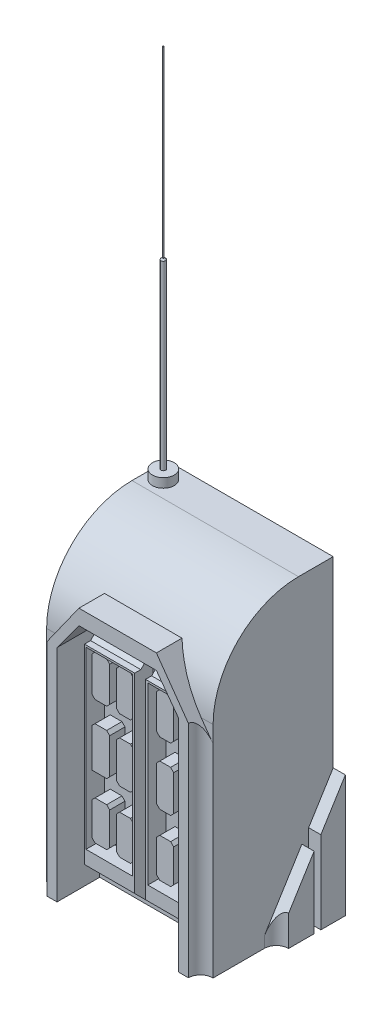
from build123d import *

# Parameters (mm, degrees)
SKETCH1_W           = 138.703768062
SKETCH1_H           = 100.037448714
BOSS_EXTRUDE1_DEPTH = 254
SKETCH2_W           = 14.801133862
SKETCH2_H           = 32.473864261
SKETCH2_W_2         = 14.135268146
SKETCH2_H_2         = 34.772366101
SKETCH2_H_3         = 34.104021324
CUT_EXTRUDE1_DEPTH  = 25.4
SKETCH2_3_W         = 14.801133862
SKETCH2_3_H         = 34.104021324
SKETCH2_3_W_2       = 14.135268146
SKETCH2_3_H_2       = 34.772366101
SKETCH2_3_H_3       = 32.473864261
CUT_EXTRUDE2_DEPTH  = 12.7
BOSS_EXTRUDE2_DEPTH = 10.16
FILLET1_R           = 71.12
CHAMFER1_SIZE       = 2.54
SKETCH3_W           = 41.849650405
SKETCH3_H           = 148.834830101
SKETCH3_W_2         = 38.660028617
SKETCH3_H_2         = 145.84015385
BOSS_EXTRUDE3_DEPTH = 15.24
BOSS_EXTRUDE4_DEPTH = 10.16
BOSS_EXTRUDE5_DEPTH = 10.16
SKETCH6_R           = 9.027087343
BOSS_EXTRUDE6_DEPTH = 7.62
SKETCH7_R           = 1.94038845
BOSS_EXTRUDE7_DEPTH = 152.4
CHAMFER2_SIZE       = 1.27
SKETCH8_R           = 0.422277869
BOSS_EXTRUDE8_DEPTH = 152.4
FILLET2_R           = 10.16
FILLET3_R           = 10.16
CHAMFER3_SIZE       = 25.4
CHAMFER4_SIZE       = 10.16
FILLET4_R           = 10.16
FILLET5_R           = 10.16


# Some blends are built 0.0001 mm under size
with BuildPart() as part:
    # Sketch1 → Boss-Extrude1 (new body)
    with BuildSketch(Plane(origin=(0, 0, 0), x_dir=(1, 0, 0), z_dir=(0, 1, 0))):
        with Locations((1.617227834, -2.755559595)):
            Rectangle(SKETCH1_W, SKETCH1_H)
    extrude(amount=BOSS_EXTRUDE1_DEPTH)

    # Sketch2 → Cut-Extrude1 (cut)
    with BuildSketch(Plane.XY.offset(52.774283952)):
        Polygon((-48.907831558, 183.578664673), (-48.907831558, 0), (52.142287226, 0), (52.142287226, 183.578664673), (33.894210103, 208.457361125), (-30.659754435, 208.457361125), align=None)
        with Locations((-35.272200607, 51.772839723)):
            Rectangle(SKETCH2_W, SKETCH2_H, mode=Mode.SUBTRACT)
        with Locations((-15.120681888, 51.772839723)):
            Rectangle(SKETCH2_W_2, SKETCH2_H, mode=Mode.SUBTRACT)
        with Locations((-35.272200607, 104.219805315)):
            Rectangle(SKETCH2_W, SKETCH2_H_2, mode=Mode.SUBTRACT)
        with Locations((-15.120681888, 104.219805315)):
            Rectangle(SKETCH2_W_2, SKETCH2_H_2, mode=Mode.SUBTRACT)
        with Locations((18.355137556, 51.772839723)):
            Rectangle(SKETCH2_W_2, SKETCH2_H, mode=Mode.SUBTRACT)
        with Locations((38.506656275, 51.772839723)):
            Rectangle(SKETCH2_W, SKETCH2_H, mode=Mode.SUBTRACT)
        with Locations((18.355137556, 104.219805315)):
            Rectangle(SKETCH2_W_2, SKETCH2_H_2, mode=Mode.SUBTRACT)
        with Locations((38.506656275, 104.219805315)):
            Rectangle(SKETCH2_W, SKETCH2_H_2, mode=Mode.SUBTRACT)
        with Locations((-35.272200607, 156.089607488)):
            Rectangle(SKETCH2_W, SKETCH2_H_3, mode=Mode.SUBTRACT)
        with Locations((-15.120681888, 156.089607488)):
            Rectangle(SKETCH2_W_2, SKETCH2_H_3, mode=Mode.SUBTRACT)
        with Locations((18.355137556, 156.089607488)):
            Rectangle(SKETCH2_W_2, SKETCH2_H_3, mode=Mode.SUBTRACT)
        with Locations((38.506656275, 156.089607488)):
            Rectangle(SKETCH2_W, SKETCH2_H_3, mode=Mode.SUBTRACT)
    extrude(amount=-CUT_EXTRUDE1_DEPTH, mode=Mode.SUBTRACT)

    # Sketch2<3> → Cut-Extrude2 (cut)
    with BuildSketch(Plane.XY.offset(52.774283952)):
        with Locations((-35.272200607, 156.089607488)):
            Rectangle(SKETCH2_3_W, SKETCH2_3_H)
        with Locations((-15.120681888, 156.089607488)):
            Rectangle(SKETCH2_3_W_2, SKETCH2_3_H)
        with Locations((-35.272200607, 104.219805315)):
            Rectangle(SKETCH2_3_W, SKETCH2_3_H_2)
        with Locations((-15.120681888, 104.219805315)):
            Rectangle(SKETCH2_3_W_2, SKETCH2_3_H_2)
        with Locations((-35.272200607, 51.772839723)):
            Rectangle(SKETCH2_3_W, SKETCH2_3_H_3)
        with Locations((-15.120681888, 51.772839723)):
            Rectangle(SKETCH2_3_W_2, SKETCH2_3_H_3)
        with Locations((18.355137556, 156.089607488)):
            Rectangle(SKETCH2_3_W_2, SKETCH2_3_H)
        with Locations((38.506656275, 156.089607488)):
            Rectangle(SKETCH2_3_W, SKETCH2_3_H)
        with Locations((38.506656275, 104.219805315)):
            Rectangle(SKETCH2_3_W, SKETCH2_3_H_2)
        with Locations((18.355137556, 104.219805315)):
            Rectangle(SKETCH2_3_W_2, SKETCH2_3_H_2)
        with Locations((18.355137556, 51.772839723)):
            Rectangle(SKETCH2_3_W_2, SKETCH2_3_H_3)
        with Locations((38.506656275, 51.772839723)):
            Rectangle(SKETCH2_3_W, SKETCH2_3_H_3)
    extrude(amount=-CUT_EXTRUDE2_DEPTH, mode=Mode.SUBTRACT)

    # Sketch2<5> → Boss-Extrude2 (add)
    with BuildSketch(Plane.XY.offset(52.774283952)):
        Polygon((-57.322808298, 183.578664673), (-57.322808298, 0), (-48.907831558, 0), (-48.907831558, 183.578664673), (-30.659754435, 208.457361125), (33.894210103, 208.457361125), (52.142287226, 183.578664673), (52.142287226, 0), (60.557263966, 0), (60.557263966, 183.578664673), (33.894210103, 221.102001876), (-30.659754435, 221.102001876), align=None)
    extrude(amount=BOSS_EXTRUDE2_DEPTH)

    # Fillet1
    # the kernel refuses this fillet: 71.12 mm, written as the material it takes off along each edge
    with BuildSketch(Plane(origin=(248.769111865, 254, 52.774283952), x_dir=(0, 0, -1), z_dir=(-1, 0, 0))) as fillet1_piece_1_section:
        with BuildLine():
            CenterArc((FILLET1_R, FILLET1_R), FILLET1_R, 180, 90)
            Line((0, FILLET1_R), (0, 0))
            Line((0, 0), (FILLET1_R, 0))
        make_face()
    fillet1_piece_1 = extrude(amount=494.303768061, mode=Mode.PRIVATE)
    fillet1_piece_1 = split(fillet1_piece_1, bisect_by=Plane(origin=(65.763187915, 221.102001876, 35.066185576), z_dir=(0, 1, 0)), keep=Keep.TOP, mode=Mode.PRIVATE)
    add(fillet1_piece_1, mode=Mode.SUBTRACT)
    with BuildSketch(Plane(origin=(248.769111865, 254, 52.774283952), x_dir=(0, 0, -1), z_dir=(-1, 0, 0))) as fillet1_piece_2_section:
        with BuildLine():
            CenterArc((FILLET1_R, FILLET1_R), FILLET1_R, 180, 90)
            Line((0, FILLET1_R), (0, 0))
            Line((0, 0), (FILLET1_R, 0))
        make_face()
    fillet1_piece_2 = extrude(amount=494.303768061, mode=Mode.PRIVATE)
    fillet1_piece_2 = split(fillet1_piece_2, bisect_by=Plane(origin=(47.159512372, 202.433532288, 48.709976317), z_dir=(0.8151626082452436, 0.5792321832553953, 0)), keep=Keep.TOP, mode=Mode.PRIVATE)
    add(fillet1_piece_2, mode=Mode.SUBTRACT)
    with BuildSketch(Plane(origin=(248.769111865, 254, 52.774283952), x_dir=(0, 0, -1), z_dir=(-1, 0, 0))) as fillet1_piece_3_section:
        with BuildLine():
            CenterArc((FILLET1_R, FILLET1_R), FILLET1_R, 180, 90)
            Line((0, FILLET1_R), (0, 0))
            Line((0, 0), (FILLET1_R, 0))
        make_face()
    fillet1_piece_3 = extrude(amount=494.303768061, mode=Mode.PRIVATE)
    fillet1_piece_3 = split(fillet1_piece_3, bisect_by=Plane(origin=(60.557263966, 183.299199574, 52.773597591), z_dir=(1, 0, 0)), keep=Keep.TOP, mode=Mode.PRIVATE)
    add(fillet1_piece_3, mode=Mode.SUBTRACT)
    with BuildSketch(Plane(origin=(248.769111865, 254, 52.774283952), x_dir=(0, 0, -1), z_dir=(-1, 0, 0))) as fillet1_piece_4_section:
        with BuildLine():
            CenterArc((FILLET1_R, FILLET1_R), FILLET1_R, 180, 90)
            Line((0, FILLET1_R), (0, 0))
            Line((0, 0), (FILLET1_R, 0))
        make_face()
    fillet1_piece_4 = extrude(amount=494.303768061, mode=Mode.PRIVATE)
    fillet1_piece_4 = split(fillet1_piece_4, bisect_by=Plane(origin=(-36.570941557, 212.783094791, 48.549077149), z_dir=(-0.8151626082452436, 0.5792321832553953, 0)), keep=Keep.TOP, mode=Mode.PRIVATE)
    add(fillet1_piece_4, mode=Mode.SUBTRACT)
    with BuildSketch(Plane(origin=(248.769111865, 254, 52.774283952), x_dir=(0, 0, -1), z_dir=(-1, 0, 0))) as fillet1_piece_5_section:
        with BuildLine():
            CenterArc((FILLET1_R, FILLET1_R), FILLET1_R, 180, 90)
            Line((0, FILLET1_R), (0, 0))
            Line((0, 0), (FILLET1_R, 0))
        make_face()
    fillet1_piece_5 = extrude(amount=494.303768061, mode=Mode.PRIVATE)
    fillet1_piece_5 = split(fillet1_piece_5, bisect_by=Plane(origin=(-57.322808298, 183.299199574, 52.773597591), z_dir=(-1, 0, 0)), keep=Keep.TOP, mode=Mode.PRIVATE)
    add(fillet1_piece_5, mode=Mode.SUBTRACT)

    # Chamfer1
    chamfer1_edges = [part.edges().sort_by_distance(p)[0] for p in [
        (45.907223206, 35.535907592, 33.724283952),
        (45.907223206, 68.009771853, 33.724283952),
        (31.106089344, 68.009771853, 33.724283952),
        (11.287503483, 35.535907592, 33.724283952),
        (25.422771629, 35.535907592, 33.724283952),
        (25.422771629, 68.009771853, 33.724283952),
        (11.287503483, 86.833622265, 33.724283952),
        (25.422771629, 86.833622265, 33.724283952),
        (25.422771629, 121.605988366, 33.724283952),
        (31.106089344, 121.605988366, 33.724283952),
        (31.106089344, 86.833622265, 33.724283952),
        (45.907223206, 86.833622265, 33.724283952),
        (-27.871633676, 35.535907592, 33.724283952),
        (-27.871633676, 68.009771853, 33.724283952),
        (-42.672767538, 68.009771853, 33.724283952),
        (-22.188315961, 121.605988366, 33.724283952),
        (-22.188315961, 86.833622265, 33.724283952),
        (-8.053047815, 86.833622265, 33.724283952),
        (-22.188315961, 173.14161815, 33.724283952),
        (-22.188315961, 139.037596826, 33.724283952),
        (-8.053047815, 139.037596826, 33.724283952),
        (-22.188315961, 35.535907592, 33.724283952),
        (-8.053047815, 35.535907592, 33.724283952),
        (-8.053047815, 68.009771853, 33.724283952),
        (-27.871633676, 139.037596826, 33.724283952),
        (-27.871633676, 173.14161815, 33.724283952),
        (-42.672767538, 173.14161815, 33.724283952),
        (-27.871633676, 86.833622265, 33.724283952),
        (-27.871633676, 121.605988366, 33.724283952),
        (-42.672767538, 121.605988366, 33.724283952),
        (25.422771629, 139.037596826, 33.724283952),
        (25.422771629, 173.14161815, 33.724283952),
        (11.287503483, 173.14161815, 33.724283952),
        (45.907223206, 173.14161815, 33.724283952),
        (31.106089344, 173.14161815, 33.724283952),
        (31.106089344, 139.037596826, 33.724283952),
        (31.106089344, 35.535907592, 33.724283952),
        (11.287503483, 68.009771853, 33.724283952),
        (11.287503483, 121.605988366, 33.724283952),
        (45.907223206, 121.605988366, 33.724283952),
        (-42.672767538, 35.535907592, 33.724283952),
        (-8.053047815, 121.605988366, 33.724283952),
        (-8.053047815, 173.14161815, 33.724283952),
        (-22.188315961, 68.009771853, 33.724283952),
        (-42.672767538, 139.037596826, 33.724283952),
        (11.287503483, 139.037596826, 33.724283952),
        (45.907223206, 139.037596826, 33.724283952),
    ]]
    chamfer(chamfer1_edges, length=CHAMFER1_SIZE)

    # Sketch3 → Boss-Extrude3 (add)
    # profile 1 of 2: a face of its own
    with BuildSketch(Plane.XY.offset(27.374283952)):
        with Locations((-25.429235498, 102.729993703)):
            Rectangle(SKETCH3_W, SKETCH3_H)
        with Locations((-25.759843441, 102.647284592)):
            Rectangle(SKETCH3_W_2, SKETCH3_H_2, mode=Mode.SUBTRACT)
    # profile 2 of 2: a face of its own
    with BuildSketch(Plane.XY.offset(27.374283952)):
        with Locations((25.429235498, 102.729993703)):
            Rectangle(SKETCH3_W, SKETCH3_H)
        with Locations((25.759843441, 102.647284592)):
            Rectangle(SKETCH3_W_2, SKETCH3_H_2, mode=Mode.SUBTRACT)
    extrude(amount=BOSS_EXTRUDE3_DEPTH)

    # Sketch4 → Boss-Extrude4 (add)
    with BuildSketch(Plane.ZY.offset(67.734656197)):
        Polygon((-47.263164762, 0), (-26.325953361, 0), (-26.325953361, 67.843997481), (-47.263164762, 101.6), align=None)
        Polygon((0, 0), (0, 25.4), (-20.622596421, 58.648764767), (-20.622596421, 0), align=None)
    extrude(amount=BOSS_EXTRUDE4_DEPTH)

    # Sketch5 → Boss-Extrude5 (add)
    with BuildSketch(Plane(origin=(70.969111865, 0, 0), x_dir=(0, 0, -1), z_dir=(1, 0, 0))):
        Polygon((0, 0), (0, 25.4), (21.213880181, 59.60206154), (21.213880181, 0), align=None)
        Polygon((47.263164762, 101.6), (47.263164762, 0), (26.829112213, 0), (26.829112213, 68.655214942), align=None)
    extrude(amount=BOSS_EXTRUDE5_DEPTH)

    # Sketch6 → Boss-Extrude6 (add)
    with BuildSketch(Plane(origin=(0, 254, 0), x_dir=(1, 0, 0), z_dir=(0, 1, 0))):
        with Locations(Location((-55.486515203, 32.221084153, 0), (0, 0, 90))):
            Circle(SKETCH6_R)
    extrude(amount=BOSS_EXTRUDE6_DEPTH)

    # Sketch7 → Boss-Extrude7 (add)
    with BuildSketch(Plane(origin=(0, 261.62, 0), x_dir=(1, 0, 0), z_dir=(0, 1, 0))):
        with Locations(Location((-55.486515203, 32.221084153, 0), (0, 0, 90))):
            Circle(SKETCH7_R)
    extrude(amount=BOSS_EXTRUDE7_DEPTH)

    # Chamfer2
    chamfer2_edges = [part.edges().sort_by_distance(p)[0] for p in [
        (-55.486515203, 414.02, -30.280695703),
    ]]
    chamfer(chamfer2_edges, length=CHAMFER2_SIZE)

    # Sketch8 → Boss-Extrude8 (add)
    with BuildSketch(Plane(origin=(0, 414.02, 0), x_dir=(1, 0, 0), z_dir=(0, 1, 0))):
        with Locations(Location((-55.486515203, 32.221084153, 0), (0, 0, 270))):
            Circle(SKETCH8_R)
    extrude(amount=BOSS_EXTRUDE8_DEPTH)

    # Fillet2
    # the kernel refuses this fillet: 10.16 mm, written as the material it adds along each edge
    with BuildSketch(Plane(origin=(-57.322808298, 208.28, 52.774283952), x_dir=(-1, 0, 0), z_dir=(0, -1, 0))) as fillet2_piece_1_section:
        with BuildLine():
            CenterArc((FILLET2_R, -FILLET2_R), FILLET2_R, 90, 90)
            Line((0, -FILLET2_R), (-FILLET2_R * 0.02, -FILLET2_R))
            Line((-FILLET2_R * 0.02, -FILLET2_R), (-FILLET2_R * 0.02, FILLET2_R * 0.02))
            Line((-FILLET2_R * 0.02, FILLET2_R * 0.02), (FILLET2_R, FILLET2_R * 0.02))
            Line((FILLET2_R, FILLET2_R * 0.02), (FILLET2_R, 0))
        make_face()
    fillet2_piece_1 = extrude(amount=208.28, mode=Mode.PRIVATE)
    fillet2_piece_1 = fillet2_piece_1 - Plane(origin=(-59.585968411, 182.88, -18.345716048), x_dir=(0, 0, -1), z_dir=(1, 0, 0)) * Cylinder(71.12, 458, mode=Mode.PRIVATE)
    fillet2_piece_1 = split(fillet2_piece_1, bisect_by=Plane(origin=(-102.188481493, 120.438493529, 55.097413319), z_dir=(0.8151626082453484, -0.5792321832552476, 0)), keep=Keep.TOP, mode=Mode.PRIVATE)
    add(fillet2_piece_1)
    with BuildSketch(Plane(origin=(-57.322808298, 208.28, 52.774283952), x_dir=(-1, 0, 0), z_dir=(0, -1, 0))) as fillet2_piece_2_section:
        with BuildLine():
            CenterArc((FILLET2_R, -FILLET2_R), FILLET2_R, 90, 90)
            Line((0, -FILLET2_R), (-FILLET2_R * 0.02, -FILLET2_R))
            Line((-FILLET2_R * 0.02, -FILLET2_R), (-FILLET2_R * 0.02, FILLET2_R * 0.02))
            Line((-FILLET2_R * 0.02, FILLET2_R * 0.02), (FILLET2_R, FILLET2_R * 0.02))
            Line((FILLET2_R, FILLET2_R * 0.02), (FILLET2_R, 0))
        make_face()
    fillet2_piece_2 = extrude(amount=208.28, mode=Mode.PRIVATE)
    fillet2_piece_2 = fillet2_piece_2 & Plane(origin=(-58.343918637, 182.88, -18.345716048), x_dir=(0, 0, -1), z_dir=(1, 0, 0)) * Cylinder(71.12, 458, mode=Mode.PRIVATE)
    fillet2_piece_2 = split(fillet2_piece_2, bisect_by=Plane(origin=(-59.15746069, 180.996729358, 52.644516297), z_dir=(0.8151626082453484, -0.5792321832552476, 0)), keep=Keep.TOP, mode=Mode.PRIVATE)
    add(fillet2_piece_2)
    with BuildSketch(Plane(origin=(-57.322808298, 208.28, 52.774283952), x_dir=(-1, 0, 0), z_dir=(0, -1, 0))) as fillet2_piece_3_section:
        with BuildLine():
            CenterArc((FILLET2_R, -FILLET2_R), FILLET2_R, 90, 90)
            Line((0, -FILLET2_R), (-FILLET2_R * 0.02, -FILLET2_R))
            Line((-FILLET2_R * 0.02, -FILLET2_R), (-FILLET2_R * 0.02, FILLET2_R * 0.02))
            Line((-FILLET2_R * 0.02, FILLET2_R * 0.02), (FILLET2_R, FILLET2_R * 0.02))
            Line((FILLET2_R, FILLET2_R * 0.02), (FILLET2_R, 0))
        make_face()
    fillet2_piece_3 = extrude(amount=208.28, mode=Mode.PRIVATE)
    fillet2_piece_3 = fillet2_piece_3 & Plane(origin=(-62.777612248, 182.88, -18.345716048), x_dir=(0, 0, -1), z_dir=(1, 0, 0)) * Cylinder(71.12, 458, mode=Mode.PRIVATE)
    fillet2_piece_3 = split(fillet2_piece_3, bisect_by=Plane(origin=(-59.342926766, 180.735720018, 52.653319863), z_dir=(-0.8151626082453484, 0.5792321832552476, 0)), keep=Keep.TOP, mode=Mode.PRIVATE)
    add(fillet2_piece_3)

    # Fillet3
    # the kernel refuses this fillet: 10.16 mm, written as the material it adds along each edge
    with BuildSketch(Plane(origin=(60.557263966, 0, 52.774283952), x_dir=(0, 0, 1), z_dir=(0, 1, 0))) as fillet3_piece_1_section:
        with BuildLine():
            CenterArc((FILLET3_R, FILLET3_R), FILLET3_R, 180, 90)
            Line((0, FILLET3_R), (-FILLET3_R * 0.02, FILLET3_R))
            Line((-FILLET3_R * 0.02, FILLET3_R), (-FILLET3_R * 0.02, -FILLET3_R * 0.02))
            Line((-FILLET3_R * 0.02, -FILLET3_R * 0.02), (FILLET3_R, -FILLET3_R * 0.02))
            Line((FILLET3_R, -FILLET3_R * 0.02), (FILLET3_R, 0))
        make_face()
    fillet3_piece_1 = extrude(amount=208.28, mode=Mode.PRIVATE)
    fillet3_piece_1 = fillet3_piece_1 - Plane(origin=(62.820424079, 182.88, -18.345716048), x_dir=(0, 0, -1), z_dir=(1, 0, 0)) * Cylinder(71.12, 458, mode=Mode.PRIVATE)
    fillet3_piece_1 = split(fillet3_piece_1, bisect_by=Plane(origin=(105.422937158, 120.438493534, 55.097413318), z_dir=(-0.8151626082453484, -0.5792321832552476, 0)), keep=Keep.TOP, mode=Mode.PRIVATE)
    add(fillet3_piece_1)
    with BuildSketch(Plane(origin=(60.557263966, 0, 52.774283952), x_dir=(0, 0, 1), z_dir=(0, 1, 0))) as fillet3_piece_2_section:
        with BuildLine():
            CenterArc((FILLET3_R, FILLET3_R), FILLET3_R, 180, 90)
            Line((0, FILLET3_R), (-FILLET3_R * 0.02, FILLET3_R))
            Line((-FILLET3_R * 0.02, FILLET3_R), (-FILLET3_R * 0.02, -FILLET3_R * 0.02))
            Line((-FILLET3_R * 0.02, -FILLET3_R * 0.02), (FILLET3_R, -FILLET3_R * 0.02))
            Line((FILLET3_R, -FILLET3_R * 0.02), (FILLET3_R, 0))
        make_face()
    fillet3_piece_2 = extrude(amount=208.28, mode=Mode.PRIVATE)
    fillet3_piece_2 = fillet3_piece_2 & Plane(origin=(66.012067922, 182.88, -18.345716048), x_dir=(0, 0, -1), z_dir=(1, 0, 0)) * Cylinder(71.12, 458, mode=Mode.PRIVATE)
    fillet3_piece_2 = split(fillet3_piece_2, bisect_by=Plane(origin=(62.577382435, 180.735720017, 52.653319863), z_dir=(0.8151626082453484, 0.5792321832552476, 0)), keep=Keep.TOP, mode=Mode.PRIVATE)
    add(fillet3_piece_2)
    with BuildSketch(Plane(origin=(60.557263966, 0, 52.774283952), x_dir=(0, 0, 1), z_dir=(0, 1, 0))) as fillet3_piece_3_section:
        with BuildLine():
            CenterArc((FILLET3_R, FILLET3_R), FILLET3_R, 180, 90)
            Line((0, FILLET3_R), (-FILLET3_R * 0.02, FILLET3_R))
            Line((-FILLET3_R * 0.02, FILLET3_R), (-FILLET3_R * 0.02, -FILLET3_R * 0.02))
            Line((-FILLET3_R * 0.02, -FILLET3_R * 0.02), (FILLET3_R, -FILLET3_R * 0.02))
            Line((FILLET3_R, -FILLET3_R * 0.02), (FILLET3_R, 0))
        make_face()
    fillet3_piece_3 = extrude(amount=208.28, mode=Mode.PRIVATE)
    fillet3_piece_3 = fillet3_piece_3 & Plane(origin=(61.578374293, 182.88, -18.345716048), x_dir=(0, 0, -1), z_dir=(1, 0, 0)) * Cylinder(71.12, 458, mode=Mode.PRIVATE)
    fillet3_piece_3 = split(fillet3_piece_3, bisect_by=Plane(origin=(62.391916357, 180.996729361, 52.644516297), z_dir=(-0.8151626082453484, -0.5792321832552476, 0)), keep=Keep.TOP, mode=Mode.PRIVATE)
    add(fillet3_piece_3)

    # Chamfer3
    # the kernel refuses this chamfer: 25.4 mm, written as the material it adds along each edge
    with BuildSketch(Plane(origin=(60.816337599, 28.312578653, 27.374283952), x_dir=(0, -0.9996219169112968, -0.02749587661058633), z_dir=(-1, 0, 0))) as chamfer3_piece_1_section:
        Polygon((CHAMFER3_SIZE * 0.999621916911, CHAMFER3_SIZE * 0.0274958766106), (-CHAMFER3_SIZE * 0.0274958766106, CHAMFER3_SIZE * 0.999621916911), (0, 0), align=None)
    chamfer3_piece_1 = extrude(amount=172.491146194, mode=Mode.PRIVATE)
    chamfer3_piece_1 = split(chamfer3_piece_1, bisect_by=Plane(origin=(46.3540607, 18.878292939, 33.905712524), z_dir=(-1, 0, 0)), keep=Keep.TOP, mode=Mode.PRIVATE)
    chamfer3_piece_1 = split(chamfer3_piece_1, bisect_by=Plane(origin=(4.504410295, 18.878292939, 33.905712524), z_dir=(1, 0, 0)), keep=Keep.TOP, mode=Mode.PRIVATE)
    chamfer3_piece_1 = split(chamfer3_piece_1, bisect_by=Plane(origin=(25.429235498, 18.878292939, 42.614283952), z_dir=(0, 0, -1)), keep=Keep.TOP, mode=Mode.PRIVATE)
    add(chamfer3_piece_1)
    with BuildSketch(Plane(origin=(-4.504410295, 28.312578653, 27.374283952), x_dir=(0, -0.9996219169112968, -0.02749587661058633), z_dir=(-1, 0, 0))) as chamfer3_piece_2_section:
        Polygon((CHAMFER3_SIZE * 0.999621916911, CHAMFER3_SIZE * 0.0274958766106), (-CHAMFER3_SIZE * 0.0274958766106, CHAMFER3_SIZE * 0.999621916911), (0, 0), align=None)
    chamfer3_piece_2 = extrude(amount=41.849650405, mode=Mode.PRIVATE)
    chamfer3_piece_2 = split(chamfer3_piece_2, bisect_by=Plane(origin=(-25.429235498, 18.878292939, 42.614283952), z_dir=(0, 0, -1)), keep=Keep.TOP, mode=Mode.PRIVATE)
    add(chamfer3_piece_2)
    with BuildSketch(Plane(origin=(-60.816337599, 28.312578653, 27.374283952), x_dir=(0, -0.9996219169112968, -0.02749587661058633), z_dir=(1, 0, 0))) as chamfer3_piece_3_section:
        Polygon((CHAMFER3_SIZE * 0.999621916911, -CHAMFER3_SIZE * 0.0274958766106), (-CHAMFER3_SIZE * 0.0274958766106, -CHAMFER3_SIZE * 0.999621916911), (0, 0), align=None)
    chamfer3_piece_3 = extrude(amount=172.491146194, mode=Mode.PRIVATE)
    chamfer3_piece_3 = split(chamfer3_piece_3, bisect_by=Plane(origin=(-46.3540607, 18.878292939, 33.905712524), z_dir=(1, 0, 0)), keep=Keep.TOP, mode=Mode.PRIVATE)
    chamfer3_piece_3 = split(chamfer3_piece_3, bisect_by=Plane(origin=(-4.504410295, 18.878292939, 33.905712524), z_dir=(-1, 0, 0)), keep=Keep.TOP, mode=Mode.PRIVATE)
    chamfer3_piece_3 = split(chamfer3_piece_3, bisect_by=Plane(origin=(-25.429235498, 18.878292939, 42.614283952), z_dir=(0, 0, -1)), keep=Keep.TOP, mode=Mode.PRIVATE)
    add(chamfer3_piece_3)
    with BuildSketch(Plane(origin=(4.504410295, 28.312578653, 27.374283952), x_dir=(0, -0.9996219169112966, -0.02749587661058633), z_dir=(1, 0, 0))) as chamfer3_piece_4_section:
        Polygon((CHAMFER3_SIZE * 0.999621916911, -CHAMFER3_SIZE * 0.0274958766106), (-CHAMFER3_SIZE * 0.0274958766106, -CHAMFER3_SIZE * 0.999621916911), (0, 0), align=None)
    chamfer3_piece_4 = extrude(amount=41.849650405, mode=Mode.PRIVATE)
    chamfer3_piece_4 = split(chamfer3_piece_4, bisect_by=Plane(origin=(25.429235498, 18.878292939, 42.614283952), z_dir=(0, 0, -1)), keep=Keep.TOP, mode=Mode.PRIVATE)
    add(chamfer3_piece_4)

    # Chamfer4
    # the kernel refuses this chamfer: 10.16 mm, written as the material it adds along each edge
    with BuildSketch(Plane(origin=(-46.3540607, 177.147408754, 27.374283952), x_dir=(0, 0.9996219169112968, -0.02749587661058625), z_dir=(1, 0, 0))) as chamfer4_piece_1:
        Polygon((CHAMFER4_SIZE * 0.999621916911, CHAMFER4_SIZE * 0.0274958766106), (-CHAMFER4_SIZE * 0.0274958766106, CHAMFER4_SIZE * 0.999621916911), (0, 0), align=None)
    extrude(amount=41.849650405)
    with BuildSketch(Plane(origin=(-72.482359858, 177.147408754, 27.374283952), x_dir=(0, 0.9996219169112968, -0.02749587661058625), z_dir=(1, 0, 0))) as chamfer4_piece_2_section:
        Polygon((CHAMFER4_SIZE * 0.999621916911, CHAMFER4_SIZE * 0.0274958766106), (-CHAMFER4_SIZE * 0.0274958766106, CHAMFER4_SIZE * 0.999621916911), (0, 0), align=None)
    chamfer4_piece_2 = extrude(amount=94.106248721, mode=Mode.PRIVATE)
    chamfer4_piece_2 = split(chamfer4_piece_2, bisect_by=Plane(origin=(4.504410295, 180.534075421, 30.760950619), z_dir=(1, 0, 0)), keep=Keep.TOP, mode=Mode.PRIVATE)
    add(chamfer4_piece_2)
    with BuildSketch(Plane(origin=(46.3540607, 177.147408754, 27.374283952), x_dir=(0, 0.9996219169112968, -0.02749587661058625), z_dir=(-1, 0, 0))) as chamfer4_piece_3:
        Polygon((CHAMFER4_SIZE * 0.999621916911, -CHAMFER4_SIZE * 0.0274958766106), (-CHAMFER4_SIZE * 0.0274958766106, -CHAMFER4_SIZE * 0.999621916911), (0, 0), align=None)
    extrude(amount=41.849650405)
    with BuildSketch(Plane(origin=(72.482359858, 177.147408754, 27.374283952), x_dir=(0, 0.9996219169112968, -0.02749587661058625), z_dir=(-1, 0, 0))) as chamfer4_piece_4_section:
        Polygon((CHAMFER4_SIZE * 0.999621916911, -CHAMFER4_SIZE * 0.0274958766106), (-CHAMFER4_SIZE * 0.0274958766106, -CHAMFER4_SIZE * 0.999621916911), (0, 0), align=None)
    chamfer4_piece_4 = extrude(amount=94.106248721, mode=Mode.PRIVATE)
    chamfer4_piece_4 = split(chamfer4_piece_4, bisect_by=Plane(origin=(-4.504410295, 180.534075421, 30.760950619), z_dir=(-1, 0, 0)), keep=Keep.TOP, mode=Mode.PRIVATE)
    add(chamfer4_piece_4)

    # Fillet4
    fillet4_edges = [part.edges().sort_by_distance(p)[0] for p in [
        (-67.734656197, 12.7, 0),
    ]]
    fillet(fillet4_edges, radius=FILLET4_R - 0.0001)  # a hair under: the kernel refuses the full size

    # Fillet5
    fillet5_edges = [part.edges().sort_by_distance(p)[0] for p in [
        (70.969111865, 12.7, 0),
    ]]
    fillet(fillet5_edges, radius=FILLET5_R - 0.0001)  # a hair under: the kernel refuses the full size


solid = part.part
